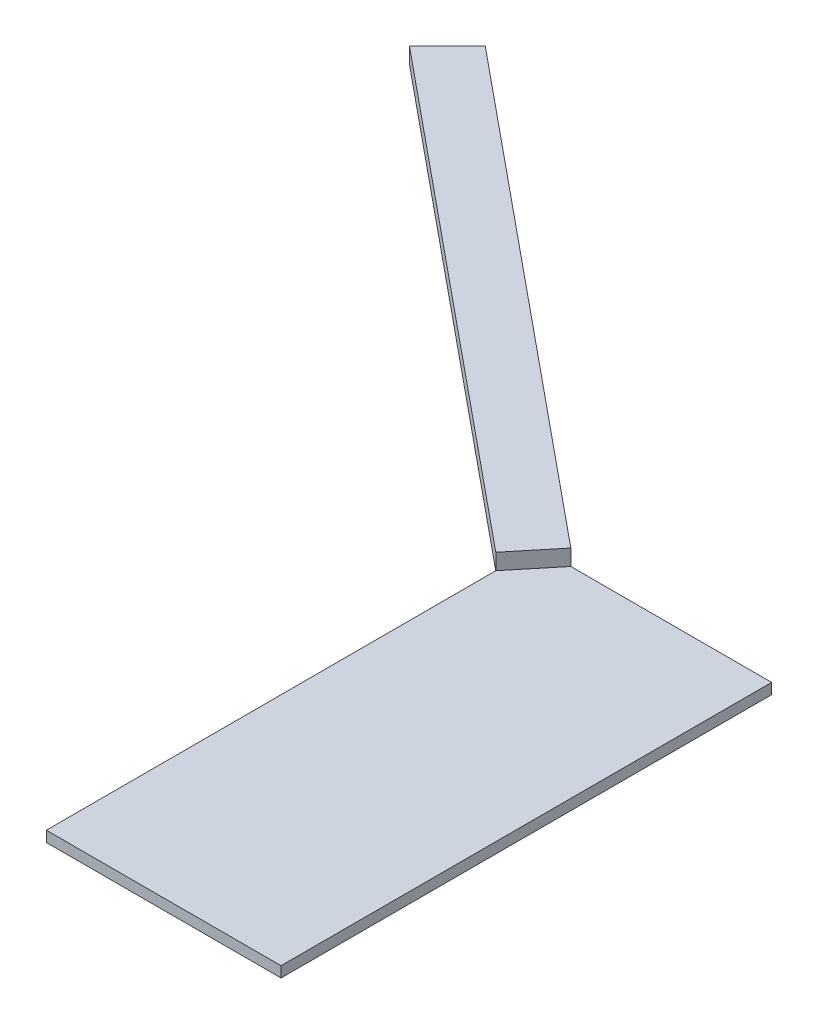
from build123d import *

# Parameters (mm, degrees)
SKETCH1_W           = 279.4
SKETCH1_H           = 584.2
BOSS_EXTRUDE1_DEPTH = 12.7
BOSS_EXTRUDE2_DEPTH = 19.05


with BuildPart() as part:
    # Sketch1 → Boss-Extrude1 (new body)
    with BuildSketch(Plane(origin=(0, 0, 0), x_dir=(1, 0, 0), z_dir=(0, 1, 0))):
        Rectangle(SKETCH1_W, SKETCH1_H)
    extrude(amount=BOSS_EXTRUDE1_DEPTH)


with BuildPart() as body_2:
    # Sketch3 → Boss-Extrude2 (new body)
    with BuildSketch(Plane(origin=(0, 12.7, 0), x_dir=(1, 0, 0), z_dir=(0, 1, 0))):
        Polygon((-139.7, 243.01607466), (-99.413299052, 292.1), (-668.024904005, 758.800361181), (-713.143195859, 713.682069327), align=None)
    extrude(amount=BOSS_EXTRUDE2_DEPTH)


solid = Compound([part.part, body_2.part])
